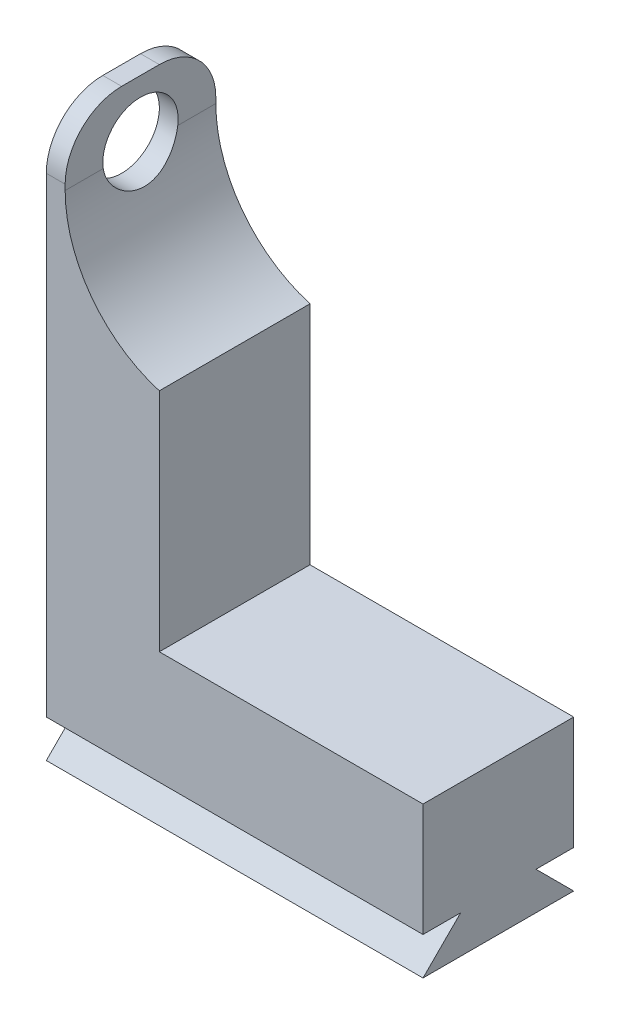
from build123d import *

# Parameters (mm, degrees)
SKETCH1_W           = 8
SKETCH1_H           = 30
BOSS_EXTRUDE1_DEPTH = 6
SKETCH2_W           = 8
SKETCH2_H           = 10
CUT_EXTRUDE1_DEPTH  = 5
CUT_EXTRUDE2_REACH  = 18.643
SKETCH3_R           = 2
FILLET1_R           = 3
FILLET2_R           = 7
SKETCH4_W           = 8
SKETCH4_H           = 8
BOSS_EXTRUDE2_DEPTH = 14
CUT_EXTRUDE4_REACH  = 27.318


with BuildPart() as part:
    # Sketch1 → Boss-Extrude1 (new body)
    with BuildSketch(Plane(origin=(0, 0, 0), x_dir=(0, 0, -1), z_dir=(1, 0, 0))):
        Rectangle(SKETCH1_W, SKETCH1_H)
    extrude(amount=BOSS_EXTRUDE1_DEPTH)

    # Sketch2 → Cut-Extrude1 (cut)
    with BuildSketch(Plane(origin=(6, 0, 0), x_dir=(0, 0, -1), z_dir=(1, 0, 0))):
        with Locations((0, 10)):
            Rectangle(SKETCH2_W, SKETCH2_H)
    extrude(amount=-CUT_EXTRUDE1_DEPTH, mode=Mode.SUBTRACT)

    # Sketch3 → Cut-Extrude2 (cut, up to next)
    with BuildSketch(Plane.ZY, mode=Mode.PRIVATE) as cut_extrude2_sk1:
        with Locations((0, 12)):
            Circle(SKETCH3_R)
    cut_extrude2_tool1 = extrude(cut_extrude2_sk1.sketch, amount=-CUT_EXTRUDE2_REACH, mode=Mode.PRIVATE) & part.part
    add(cut_extrude2_tool1.solids().sort_by_distance((0, 12, 0))[0], mode=Mode.SUBTRACT)

    # Fillet1
    fillet1_edges = [part.edges().sort_by_distance(p)[0] for p in [
        (0.5, 15, 4),
        (0.5, 15, -4),
    ]]
    fillet(fillet1_edges, radius=FILLET1_R)

    # Fillet2
    # the kernel refuses this fillet: 7 mm, written as the material it adds along each edge
    with BuildSketch(Plane(origin=(1, 5, 4), x_dir=(0, 1, 0), z_dir=(0, 0, -1))) as fillet2_piece_1_section:
        with BuildLine():
            CenterArc((6.708203932, 7), FILLET2_R, 196.601549599, 73.398450401)
            Line((0, 5), (0, 0))
            Line((0, 0), (6.708203932, 0))
        make_face()
    fillet2_piece_1 = extrude(amount=8, mode=Mode.PRIVATE)
    fillet2_piece_1 = fillet2_piece_1 - Plane(origin=(1, 12, 0), x_dir=(0, 0, 1), z_dir=(-1, 0, 0)) * Cylinder(2, 43, mode=Mode.PRIVATE)
    add(fillet2_piece_1)

    # Sketch4 → Boss-Extrude2 (add)
    with BuildSketch(Plane(origin=(6, 0, 0), x_dir=(0, 0, -1), z_dir=(1, 0, 0))):
        with Locations((0, -11)):
            Rectangle(SKETCH4_W, SKETCH4_H)
    extrude(amount=BOSS_EXTRUDE2_DEPTH)

    # Sketch6 → Cut-Extrude4 (cut, up to next)
    with BuildSketch(Plane.ZY, mode=Mode.PRIVATE) as cut_extrude4_sk1:
        Polygon((4, -15), (4, -13), (2, -13), align=None)
    cut_extrude4_tool1 = extrude(cut_extrude4_sk1.sketch, amount=-CUT_EXTRUDE4_REACH, mode=Mode.PRIVATE) & part.part
    # Sketch6 → Cut-Extrude4 (cut, up to next)
    with BuildSketch(Plane.ZY, mode=Mode.PRIVATE) as cut_extrude4_sk2:
        Polygon((-4, -15), (-4, -13), (-2, -13), align=None)
    cut_extrude4_tool2 = extrude(cut_extrude4_sk2.sketch, amount=-CUT_EXTRUDE4_REACH, mode=Mode.PRIVATE) & part.part
    add(cut_extrude4_tool1.solids().sort_by_distance((0, -13.666667, 3.333333))[0], mode=Mode.SUBTRACT)
    add(cut_extrude4_tool2.solids().sort_by_distance((0, -13.666667, -3.333333))[0], mode=Mode.SUBTRACT)


solid = part.part
